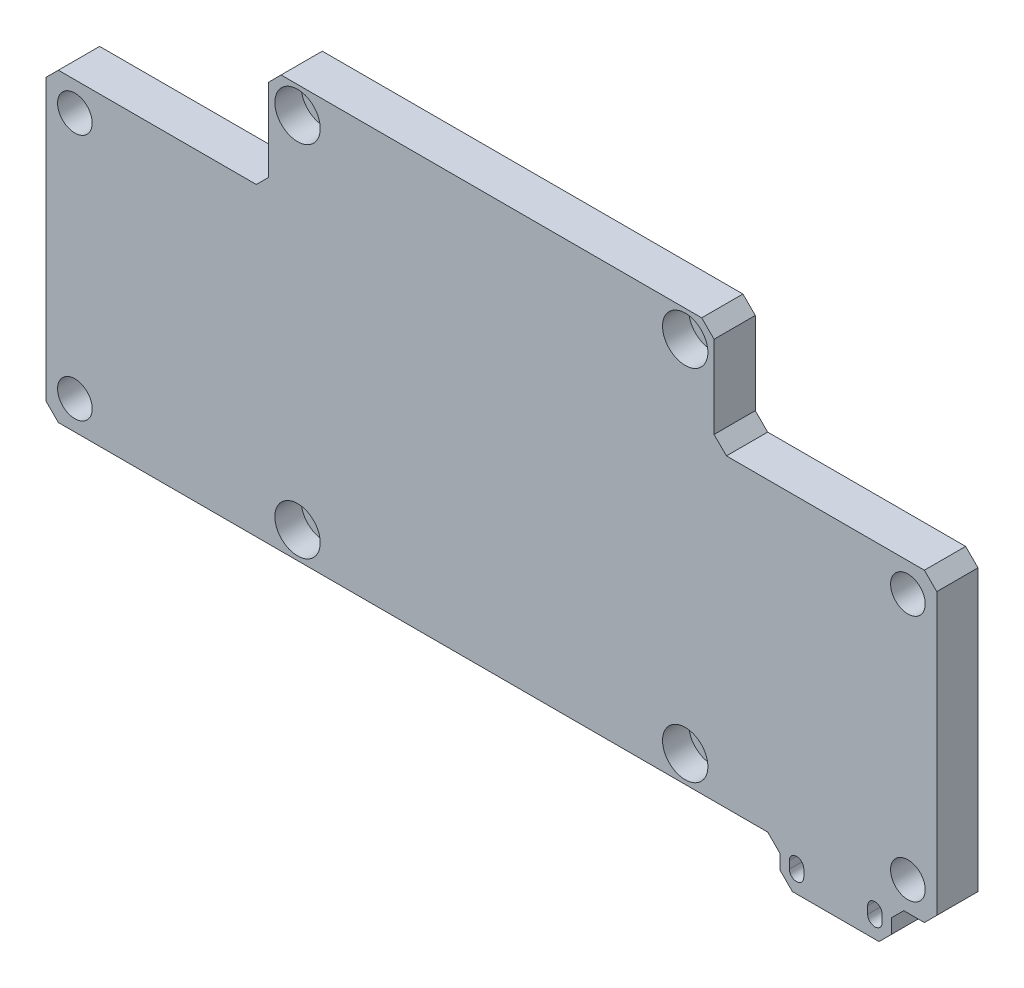
from build123d import *

# Parameters (mm, degrees)
SKIZZE1_W                                            = 216
SKIZZE1_H                                            = 100
AUFSATZ_LINEAR_AUSTRAGEN1_DEPTH                      = 10
STIRNSENKUNG_F_R_M6_ZYLINDERSCHRAUBE_MIT_D           = 6.6
STIRNSENKUNG_F_R_M6_ZYLINDERSCHRAUBE_MIT_DEPTH       = 15
STIRNSENKUNG_F_R_M6_ZYLINDERSCHRAUBE_MIT_CBORE_D     = 11
STIRNSENKUNG_F_R_M6_ZYLINDERSCHRAUBE_MIT_CBORE_DEPTH = 6.4
STIRNSENKUNG_F_R_M6_ZYLINDERSCHRAUBE_MIT_TIP         = 1.982840043
CBORE_FOR_M6_HEX_SOCKET_HEAD_CAP_SCREW1_D            = 6.6
CBORE_FOR_M6_HEX_SOCKET_HEAD_CAP_SCREW1_DEPTH        = 15
CBORE_FOR_M6_HEX_SOCKET_HEAD_CAP_SCREW1_CBORE_D      = 11
CBORE_FOR_M6_HEX_SOCKET_HEAD_CAP_SCREW1_CBORE_DEPTH  = 6.4
CBORE_FOR_M6_HEX_SOCKET_HEAD_CAP_SCREW1_TIP          = 1.982840043
M8_CLEARANCE_HOLE1_D                                 = 8.4
M8_CLEARANCE_HOLE1_DEPTH                             = 17
M8_CLEARANCE_HOLE1_TIP                               = 2.5236146
SKIZZE18_W                                           = 54
SKIZZE18_H                                           = 26
SCHNITT_LINEAR_AUSTRAGEN1_DEPTH                      = 15
SKETCH1_W                                            = 27
SKETCH1_H                                            = 10
BOSS_EXTRUDE1_DEPTH                                  = 9.5
CUT_EXTRUDE1_DEPTH                                   = 10
LPATTERN1_COUNT                                      = 2
LPATTERN1_PITCH                                      = 19
CUT_EXTRUDE2_START                                   = -10
CUT_EXTRUDE2_DEPTH                                   = 3
LPATTERN2_COUNT                                      = 2
LPATTERN2_PITCH                                      = 19
MIRROR1_COPY_1_DEPTH                                 = 10
MIRROR1_START                                        = -10
MIRROR1_COPY_2_DEPTH                                 = 3
SKETCH5_W                                            = 27
SKETCH5_H                                            = 9.5
CUT_EXTRUDE3_DEPTH                                   = 10
CHAMFER4_SIZE                                        = 3
CHAMFER5_SIZE                                        = 3


with BuildPart() as part:
    # Skizze1 → Aufsatz-Linear austragen1 (new body)
    with BuildSketch(Plane.XY):
        Rectangle(SKIZZE1_W, SKIZZE1_H)
    extrude(amount=AUFSATZ_LINEAR_AUSTRAGEN1_DEPTH)

    # Stirnsenkung für M6 Zylinderschraube mit Innensechskant1
    with Locations(Plane.XY.offset(10)):
        with Locations((-47, -43.5), (47, -43.5)):
            CounterBoreHole(STIRNSENKUNG_F_R_M6_ZYLINDERSCHRAUBE_MIT_D / 2, STIRNSENKUNG_F_R_M6_ZYLINDERSCHRAUBE_MIT_CBORE_D / 2, STIRNSENKUNG_F_R_M6_ZYLINDERSCHRAUBE_MIT_CBORE_DEPTH, depth=STIRNSENKUNG_F_R_M6_ZYLINDERSCHRAUBE_MIT_DEPTH)
            with Locations((0, 0, -(STIRNSENKUNG_F_R_M6_ZYLINDERSCHRAUBE_MIT_DEPTH + STIRNSENKUNG_F_R_M6_ZYLINDERSCHRAUBE_MIT_TIP / 2))):  # 118° drill point
                Cone(0, STIRNSENKUNG_F_R_M6_ZYLINDERSCHRAUBE_MIT_D / 2, STIRNSENKUNG_F_R_M6_ZYLINDERSCHRAUBE_MIT_TIP, mode=Mode.SUBTRACT)

    # CBORE for M6 Hex Socket Head Cap Screw1
    with Locations(Plane.XY.offset(10)):
        with Locations((-47, 43.5), (47, 43.5)):
            CounterBoreHole(CBORE_FOR_M6_HEX_SOCKET_HEAD_CAP_SCREW1_D / 2, CBORE_FOR_M6_HEX_SOCKET_HEAD_CAP_SCREW1_CBORE_D / 2, CBORE_FOR_M6_HEX_SOCKET_HEAD_CAP_SCREW1_CBORE_DEPTH, depth=CBORE_FOR_M6_HEX_SOCKET_HEAD_CAP_SCREW1_DEPTH)
            with Locations((0, 0, -(CBORE_FOR_M6_HEX_SOCKET_HEAD_CAP_SCREW1_DEPTH + CBORE_FOR_M6_HEX_SOCKET_HEAD_CAP_SCREW1_TIP / 2))):  # 118° drill point
                Cone(0, CBORE_FOR_M6_HEX_SOCKET_HEAD_CAP_SCREW1_D / 2, CBORE_FOR_M6_HEX_SOCKET_HEAD_CAP_SCREW1_TIP, mode=Mode.SUBTRACT)

    # M8 Clearance Hole1
    with Locations(Plane.XY.offset(10)):
        with Locations((-101, 17), (-101, -43), (101, 17), (101, -43)):
            Hole(M8_CLEARANCE_HOLE1_D / 2, depth=M8_CLEARANCE_HOLE1_DEPTH)
            with Locations((0, 0, -(M8_CLEARANCE_HOLE1_DEPTH + M8_CLEARANCE_HOLE1_TIP / 2))):  # 118° drill point
                Cone(0, M8_CLEARANCE_HOLE1_D / 2, M8_CLEARANCE_HOLE1_TIP, mode=Mode.SUBTRACT)

    # Skizze18 → Schnitt-Linear austragen1 (cut)
    with BuildSketch(Plane.XY.offset(10)):
        with Locations((-81, 37)):
            Rectangle(SKIZZE18_W, SKIZZE18_H)
    schnitt_linear_austragen1 = extrude(amount=-SCHNITT_LINEAR_AUSTRAGEN1_DEPTH, mode=Mode.SUBTRACT)

    # Spiegeln1: Schnitt-Linear austragen1 across plane
    add(schnitt_linear_austragen1.mirror(Plane(origin=(0, 0, 0), x_dir=(0, 0, 1), z_dir=(1, 0, 0))), mode=Mode.SUBTRACT)

    # Sketch1 → Boss-Extrude1 (add)
    with BuildSketch(Plane(origin=(0, 24, 0), x_dir=(1, 0, 0), z_dir=(0, 1, 0))):
        with Locations((83.5, -5)):
            Rectangle(SKETCH1_W, SKETCH1_H)
    boss_extrude1 = extrude(amount=BOSS_EXTRUDE1_DEPTH)

    # Sketch3 → Cut-Extrude1 (cut)
    with BuildSketch(Plane(origin=(0, 0, 0), x_dir=(-1, 0, 0), z_dir=(0, 0, -1))):
        with BuildLine():
            Line((-91.25, 29.15), (-91.25, 27.35))
            ThreePointArc((-91.25, 27.35), (-93, 25.6), (-94.75, 27.35))
            Line((-94.75, 27.35), (-94.75, 29.15))
            ThreePointArc((-94.75, 29.15), (-93, 30.9), (-91.25, 29.15))
        make_face()
    cut_extrude1 = extrude(amount=-CUT_EXTRUDE1_DEPTH, mode=Mode.SUBTRACT)

    # LPattern1: Cut-Extrude1 ×2
    with Locations(*[(-i * LPATTERN1_PITCH, 0, 0) for i in range(1, LPATTERN1_COUNT)]):
        add(cut_extrude1, mode=Mode.SUBTRACT)

    # Sketch4 → Cut-Extrude2 (cut)
    with BuildSketch(Plane.XY.offset(10).offset(CUT_EXTRUDE2_START)):
        Polygon((74, 32.383161507), (71.2, 30.766580754), (71.2, 28.375279034), (71.2, 25.733419246), (74, 24.116838493), (76.8, 25.733419246), (76.8, 28.372780006), (76.8, 30.766580754), align=None)
    cut_extrude2 = extrude(amount=CUT_EXTRUDE2_DEPTH, mode=Mode.SUBTRACT)

    # LPattern2: Cut-Extrude2 ×2
    with Locations(*[(i * LPATTERN2_PITCH, 0, 0) for i in range(1, LPATTERN2_COUNT)]):
        add(cut_extrude2, mode=Mode.SUBTRACT)

    # Mirror1: Boss-Extrude1, Cut-Extrude1, Cut-Extrude2 across plane
    add(boss_extrude1.mirror(Plane.ZX.offset(-13)))
    add(cut_extrude1.mirror(Plane.ZX.offset(-13)), mode=Mode.SUBTRACT)
    add(cut_extrude2.mirror(Plane.ZX.offset(-13)), mode=Mode.SUBTRACT)

    # Mirror1 copy 1 sketch → Mirror1 copy 1 (cut)
    with BuildSketch(Plane(origin=(-19, -26, 0), x_dir=(-1, 0, 0), z_dir=(0, 0, -1))):
        with BuildLine():
            Line((-91.25, -29.15), (-91.25, -27.35))
            ThreePointArc((-91.25, -27.35), (-93, -25.6), (-94.75, -27.35))
            Line((-94.75, -27.35), (-94.75, -29.15))
            ThreePointArc((-94.75, -29.15), (-93, -30.9), (-91.25, -29.15))
        make_face()
    extrude(amount=-MIRROR1_COPY_1_DEPTH, mode=Mode.SUBTRACT)

    # Mirror1 copy 2 sketch → Mirror1 copy 2 (cut)
    with BuildSketch(Plane(origin=(19, -26, 10), x_dir=(1, 0, 0), z_dir=(0, 0, 1)).offset(MIRROR1_START)):
        Polygon((74, -32.383161507), (71.2, -30.766580754), (71.2, -28.375279034), (71.2, -25.733419246), (74, -24.116838493), (76.8, -25.733419246), (76.8, -28.372780006), (76.8, -30.766580754), align=None)
    extrude(amount=MIRROR1_COPY_2_DEPTH, mode=Mode.SUBTRACT)

    # Sketch5 → Cut-Extrude3 (cut)
    with BuildSketch(Plane.XY.offset(10)):
        with Locations((83.5, 28.75)):
            Rectangle(SKETCH5_W, SKETCH5_H)
    extrude(amount=-CUT_EXTRUDE3_DEPTH, mode=Mode.SUBTRACT)

    # Chamfer4
    chamfer4_edges = [part.edges().sort_by_distance(p)[0] for p in [
        (-54, 24, 5),
        (54, 24, 5),
        (70, -59.5, 5),
        (97, -59.5, 5),
        (97, -50, 5),
        (70, -50, 5),
    ]]
    chamfer(chamfer4_edges, length=CHAMFER4_SIZE)

    # Chamfer5
    chamfer5_edges = [part.edges().sort_by_distance(p)[0] for p in [
        (-54, 50, 5),
        (54, 50, 5),
        (108, -50, 5),
        (108, 24, 5),
        (-108, -50, 5),
        (-108, 24, 5),
    ]]
    chamfer(chamfer5_edges, length=CHAMFER5_SIZE)


solid = part.part
